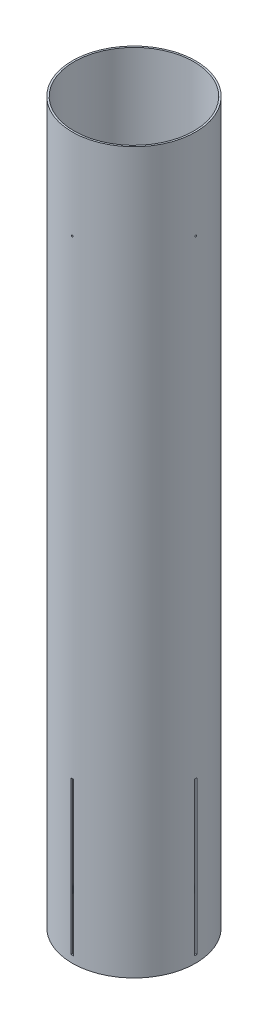
from build123d import *

# Parameters (mm, degrees)
SKETCH1_R                 = 78.359
SKETCH1_R_2               = 76.2
BOSS_EXTRUDE1_DEPTH       = 914.4
FIN_SLOTS_DEPTH           = 922.090454712
CIRPATTERN1_COUNT         = 4
SKETCH3_R                 = 3.175
CUT_EXTRUDE3_DEPTH        = 922.090454712
SKETCH2_4_R               = 1.0922
SHEAR_SCREW_HOLES_DEPTH   = 922.090454829
SHEAR_SCREW_PATTERN_COUNT = 4


with BuildPart() as part:
    # Sketch1 → Boss-Extrude1 (new body)
    with BuildSketch(Plane(origin=(0, 0, 0), x_dir=(1, 0, 0), z_dir=(0, 1, 0))):
        Circle(SKETCH1_R)
        Circle(SKETCH1_R_2, mode=Mode.SUBTRACT)
    extrude(amount=BOSS_EXTRUDE1_DEPTH)

    # Sketch2 → Fin Slots (cut, through all)
    with BuildSketch(Plane(origin=(0, 0, 0), x_dir=(0, 0, -1), z_dir=(1, 0, 0))):
        Polygon((0, 8.89), (1.5875, 8.89), (1.5875, 203.2), (-1.5875, 203.2), (-1.5875, 8.89), align=None)
    fin_slots = extrude(amount=-FIN_SLOTS_DEPTH, mode=Mode.SUBTRACT)

    # CirPattern1: Fin Slots ×4 about axis
    cirpattern1_axis = Axis((0, 0, 0), (0, 1, 0))
    for i in range(1, CIRPATTERN1_COUNT):
        add(fin_slots.rotate(cirpattern1_axis, i * 360 / CIRPATTERN1_COUNT), mode=Mode.SUBTRACT)

    # Sketch3 → Cut-Extrude3 (cut, through all)
    with BuildSketch(Plane(origin=(0, 0, 0), x_dir=(0.7071067811865477, 0, -0.7071067811865475), z_dir=(0.7071067811865475, 0, 0.7071067811865477))):
        with Locations((0, 127)):
            Circle(SKETCH3_R)
    extrude(amount=-CUT_EXTRUDE3_DEPTH, mode=Mode.SUBTRACT)

    # Sketch2<4> → Shear Screw Holes (cut, through all)
    with BuildSketch(Plane(origin=(0, 0, 0), x_dir=(0, 0, -1), z_dir=(1, 0, 0))):
        with Locations((0, 800.1)):
            Circle(SKETCH2_4_R)
    shear_screw_holes = extrude(amount=-SHEAR_SCREW_HOLES_DEPTH, mode=Mode.SUBTRACT)

    # Shear Screw Pattern: Shear Screw Holes ×4 about axis
    shear_screw_pattern_axis = Axis((0, 914.4, 0), (0, -1, 0))
    for i in range(1, SHEAR_SCREW_PATTERN_COUNT):
        add(shear_screw_holes.rotate(shear_screw_pattern_axis, i * 360 / SHEAR_SCREW_PATTERN_COUNT), mode=Mode.SUBTRACT)


solid = part.part
